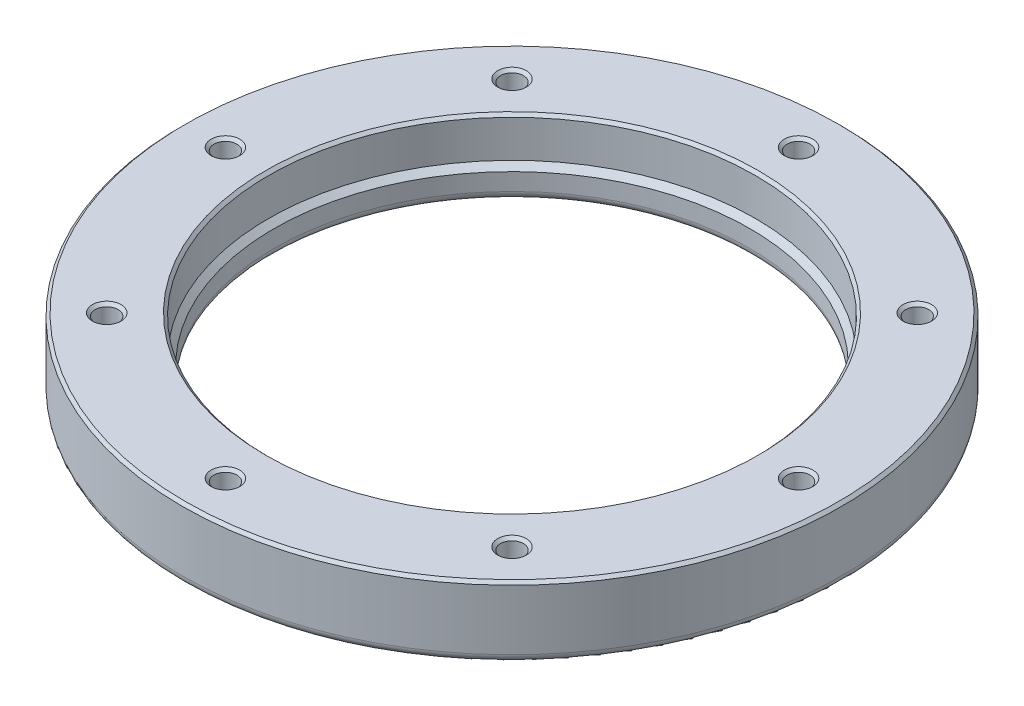
from build123d import *

# Parameters (mm, degrees)
SKETCH2_R           = 115
BOSS_EXTRUDE1_DEPTH = 25
SKETCH3_R           = 85
CUT_EXTRUDE1_DEPTH  = 16
SKETCH4_R           = 83
CUT_EXTRUDE2_DEPTH  = 164.419705054
CHAMFER3_SIZE       = 2
CHAMFER5_SIZE       = 1
FILLET1_R           = 3
SKETCH5_R           = 4
CUT_EXTRUDE3_DEPTH  = 15
SKETCH6_R           = 6
CUT_EXTRUDE4_DEPTH  = 10
CHAMFER6_SIZE       = 1


with BuildPart() as part:
    # Sketch2 → Boss-Extrude1 (new body)
    with BuildSketch(Plane(origin=(0, 0, 0), x_dir=(1, 0, 0), z_dir=(0, 1, 0))):
        with Locations(Location((0, 0, 0), (0, 0, 270))):
            Circle(SKETCH2_R)
    extrude(amount=BOSS_EXTRUDE1_DEPTH)

    # Sketch3 → Cut-Extrude1 (cut)
    with BuildSketch(Plane(origin=(0, 25, 0), x_dir=(1, 0, 0), z_dir=(0, 1, 0))):
        with Locations(Location((0, 0, 0), (0, 0, 270))):
            Circle(SKETCH3_R)
    extrude(amount=-CUT_EXTRUDE1_DEPTH, mode=Mode.SUBTRACT)

    # Sketch4 → Cut-Extrude2 (cut, through all)
    with BuildSketch(Plane(origin=(0, 9, 0), x_dir=(1, 0, 0), z_dir=(0, 1, 0))):
        with Locations(Location((0, 0, 0), (0, 0, 270))):
            Circle(SKETCH4_R)
    extrude(amount=-CUT_EXTRUDE2_DEPTH, mode=Mode.SUBTRACT)

    # Chamfer3
    chamfer3_edges = [part.edges().sort_by_distance(p)[0] for p in [
        (0, 9, -85),
    ]]
    chamfer(chamfer3_edges, length=CHAMFER3_SIZE - 0.0001)  # a hair under: the kernel refuses the full size

    # Chamfer5
    chamfer5_edges = [part.edges().sort_by_distance(p)[0] for p in [
        (0, 25, -115),
        (0, 25, -85),
    ]]
    chamfer(chamfer5_edges, length=CHAMFER5_SIZE)

    # Fillet1
    fillet1_edges = [part.edges().sort_by_distance(p)[0] for p in [
        (0, 0, -83),
        (0, 0, -115),
    ]]
    fillet(fillet1_edges, radius=FILLET1_R)

    # Sketch5 → Cut-Extrude3 (cut)
    with BuildSketch(Plane(origin=(0, 25, 0), x_dir=(1, 0, 0), z_dir=(0, 1, 0))):
        with Locations(Location((-100, 0, 0), (0, 0, 270))):
            Circle(SKETCH5_R)
        with Locations(Location((-70.710678119, 70.710678119, 0), (0, 0, 270))):
            Circle(SKETCH5_R)
        with Locations(Location((0, 100, 0), (0, 0, 270))):
            Circle(SKETCH5_R)
        with Locations(Location((70.710678119, 70.710678119, 0), (0, 0, 270))):
            Circle(SKETCH5_R)
        with Locations(Location((100, 0, 0), (0, 0, 270))):
            Circle(SKETCH5_R)
        with Locations(Location((70.710678119, -70.710678119, 0), (0, 0, 270))):
            Circle(SKETCH5_R)
        with Locations(Location((0, -100, 0), (0, 0, 270))):
            Circle(SKETCH5_R)
        with Locations(Location((-70.710678119, -70.710678119, 0), (0, 0, 270))):
            Circle(SKETCH5_R)
    extrude(amount=-CUT_EXTRUDE3_DEPTH, mode=Mode.SUBTRACT)

    # Sketch6 → Cut-Extrude4 (cut)
    with BuildSketch(Plane.XZ):
        with Locations(Location((-100, 0, 0), (0, 0, 270))):
            Circle(SKETCH6_R)
        with Locations(Location((-70.710678119, 70.710678119, 0), (0, 0, 270))):
            Circle(SKETCH6_R)
        with Locations(Location((0, 100, 0), (0, 0, 270))):
            Circle(SKETCH6_R)
        with Locations(Location((70.710678119, 70.710678119, 0), (0, 0, 270))):
            Circle(SKETCH6_R)
        with Locations(Location((100, 0, 0), (0, 0, 270))):
            Circle(SKETCH6_R)
        with Locations(Location((70.710678119, -70.710678119, 0), (0, 0, 270))):
            Circle(SKETCH6_R)
        with Locations(Location((0, -100, 0), (0, 0, 270))):
            Circle(SKETCH6_R)
        with Locations(Location((-70.710678119, -70.710678119, 0), (0, 0, 270))):
            Circle(SKETCH6_R)
    extrude(amount=-CUT_EXTRUDE4_DEPTH, mode=Mode.SUBTRACT)

    # Chamfer6
    chamfer6_edges = [part.edges().sort_by_distance(p)[0] for p in [
        (-100, 25, -4),
        (-70.710678119, 25, -74.710678119),
        (0, 25, -104),
        (70.710678119, 25, -74.710678119),
        (100, 25, -4),
        (70.710678119, 25, 66.710678119),
        (0, 25, 96),
        (-70.710678119, 25, 66.710678119),
    ]]
    chamfer(chamfer6_edges, length=CHAMFER6_SIZE)


solid = part.part
